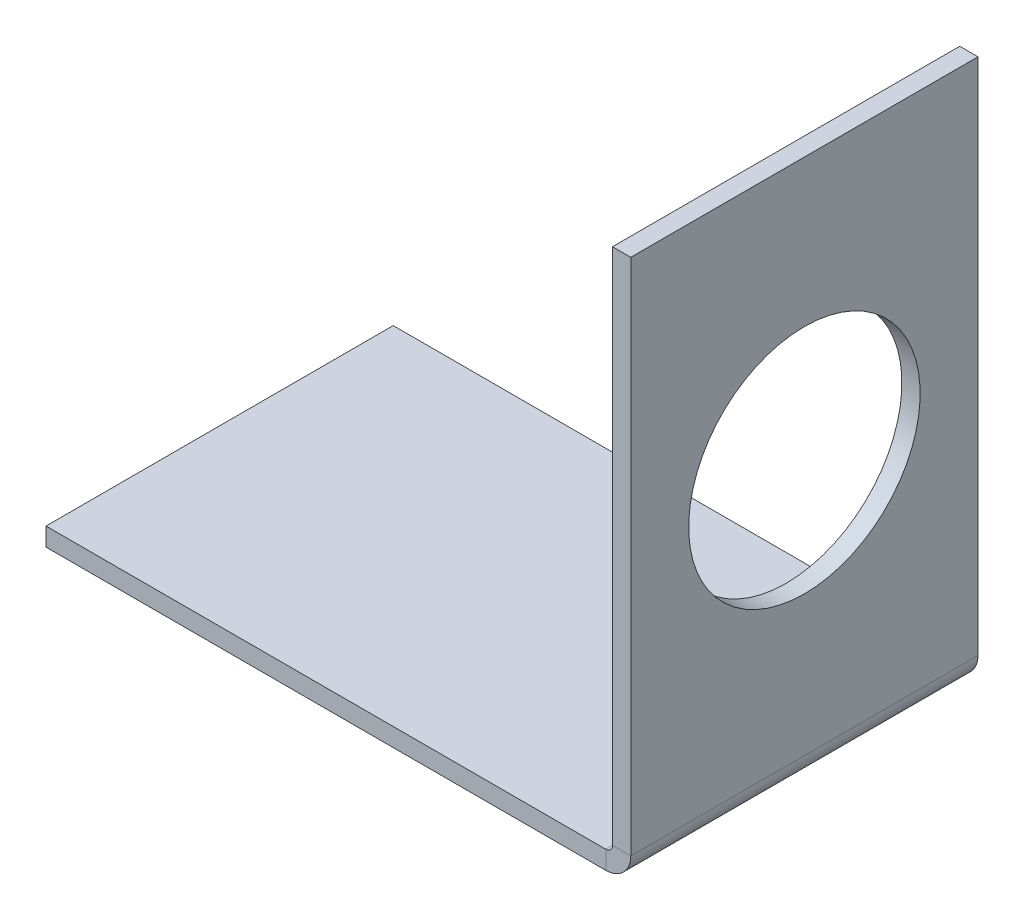
from build123d import *

# Parameters (mm, degrees)
SKETCH_1_W                       = 62
SKETCH_1_H                       = 38
SM_BASE_FLANGE_1_DEPTH           = 2
SM_EDGE_FLANGE_1_STRIP_W         = 9.4732
SM_EDGE_FLANGE_1_STRIP_H         = 2
SM_EDGE_FLANGE_1_STRIP_CUT_DEPTH = 38
SM_EDGE_FLANGE_1_DEPTH           = 38
SM_START                         = 2
SM_EDGE_FLANGE_1_PROFILE_W       = 38
SM_EDGE_FLANGE_1_PROFILE_H       = 56.7366
SM_EDGE_FLANGE_1_PROFILE_R       = 12.668336417
SM_EDGE_FLANGE_1_FLAT_DEPTH      = 2


# Sheet-metal steps are written as plain solids
with BuildPart() as part:
    # Sketch 1 → 基材-凸緣1 (new body)
    with BuildSketch(Plane(origin=(0, 0, 0), x_dir=(1, 0, 0), z_dir=(0, 1, 0))):
        Rectangle(SKETCH_1_W, SKETCH_1_H)
    extrude(amount=SM_BASE_FLANGE_1_DEPTH)

    # 邊線-凸緣1 strip (across the edge) → 邊線-凸緣1 strip cut (cut)
    with BuildSketch(Plane(origin=(31, 2, 19), x_dir=(-1, 0, 0), z_dir=(0, 0, -1))):
        with Locations((-4, -1)):
            Rectangle(SM_EDGE_FLANGE_1_STRIP_W, SM_EDGE_FLANGE_1_STRIP_H)
    extrude(amount=SM_EDGE_FLANGE_1_STRIP_CUT_DEPTH, mode=Mode.SUBTRACT)

    # 邊線-凸緣1 bend section (across the edge) → 邊線-凸緣1 (add)
    with BuildSketch(Plane(origin=(31, 2, 19), x_dir=(-1, 0, 0), z_dir=(0, 0, -1))):
        with BuildLine():
            Line((-2, 0.7366), (0, 0.7366))
            ThreePointArc((0, 0.7366), (0.215745145, 0.215745145), (0.7366, 0))
            Line((0.7366, 0), (0.7366, -2))
            ThreePointArc((0.7366, -2), (-1.198468417, -1.198468417), (-2, 0.7366))
        make_face()
    extrude(amount=SM_EDGE_FLANGE_1_DEPTH)

    # 邊線-凸緣1 profile (on flange) → 邊線-凸緣1 flat (add)
    with BuildSketch(Plane(origin=(31, 2, 0), x_dir=(0, 0, -1), z_dir=(1, 0, 0)).offset(SM_START)):
        with Locations((0, 29.1049)):
            Rectangle(SM_EDGE_FLANGE_1_PROFILE_W, SM_EDGE_FLANGE_1_PROFILE_H)
        with Locations((0, 28.7366)):
            Circle(SM_EDGE_FLANGE_1_PROFILE_R, mode=Mode.SUBTRACT)
    extrude(amount=-SM_EDGE_FLANGE_1_FLAT_DEPTH)


solid = part.part
